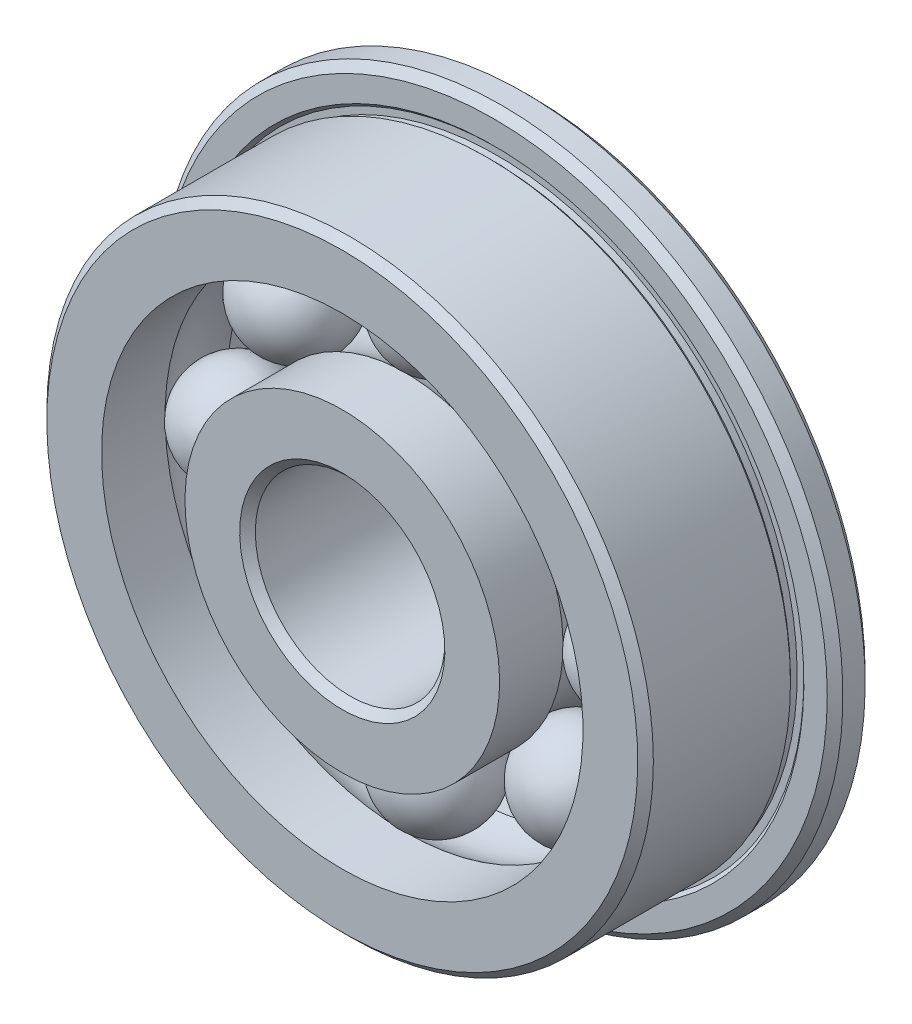
from build123d import *

# Parameters (mm, degrees)
FILLET1_SIZE      = 0.20625
FILLET2_SIZE      = 0.20625
CIRPATTERN3_COUNT = 8


with BuildPart() as part:
    # Sketch2 → Revolve1 (revolve)
    with BuildSketch(Plane(origin=(0, 0, 0), x_dir=(0, 0, -1), z_dir=(1, 0, 0))):
        with BuildLine():
            Line((2.5, 9), (1.5, 9))
            Line((1.5, 9), (1.5, 8.176776695))
            Line((1.5, 8.176776695), (1.588388348, 8.088388348))
            Line((1.588388348, 8.088388348), (1.588388348, 7.911611652))
            Line((1.588388348, 7.911611652), (1.411611652, 7.911611652))
            Line((1.411611652, 7.911611652), (1.323223305, 8))
            Line((1.323223305, 8), (-2.5, 8))
            Line((-2.5, 8), (-2.5, 6.35))
            Line((-2.5, 6.35), (-0.825, 6.35))
            ThreePointArc((-0.825, 6.35), (0, 6.625), (0.825, 6.35))
            Line((0.825, 6.35), (2.5, 6.35))
            Line((2.5, 6.35), (2.5, 9))
        make_face()
        with BuildLine():
            Line((2.5, 2.5), (-2.5, 2.5))
            Line((-2.5, 2.5), (-2.5, 4.15))
            Line((-2.5, 4.15), (-0.825, 4.15))
            ThreePointArc((-0.825, 4.15), (0, 3.875), (0.825, 4.15))
            Line((0.825, 4.15), (2.5, 4.15))
            Line((2.5, 4.15), (2.5, 2.5))
        make_face()
    revolve(axis=Axis((0, 0, 0), (0, 0, -1)))

    # Fillet1
    fillet1_edges = [part.edges().sort_by_distance(p)[0] for p in [
        (0, -9, -2.5),
        (0, -9, -1.5),
        (0, -8, 2.5),
    ]]
    chamfer(fillet1_edges, length=FILLET1_SIZE)

    # Fillet2
    fillet2_edges = [part.edges().sort_by_distance(p)[0] for p in [
        (0, -2.5, -2.5),
        (0, -2.5, 2.5),
    ]]
    chamfer(fillet2_edges, length=FILLET2_SIZE)


with BuildPart() as body_2:
    # Sketch7 → Revolve3 (revolve)
    with BuildSketch(Plane.XY):
        with BuildLine():
            Line((0, 6.625), (0, 3.875))
            ThreePointArc((0, 3.875), (-1.375, 5.25), (0, 6.625))
        make_face()
    revolve(axis=Axis((0, 6.625, 0), (0, -1, 0)))


with BuildPart() as cirpattern3_1:
    # CirPattern3: pattern copy
    add(body_2.part.rotate(Axis((0, 0, 0), (0, 0, -1)), 1 * 360 / CIRPATTERN3_COUNT))


with BuildPart() as cirpattern3_2:
    # CirPattern3: pattern copy
    add(body_2.part.rotate(Axis((0, 0, 0), (0, 0, -1)), 2 * 360 / CIRPATTERN3_COUNT))


with BuildPart() as cirpattern3_3:
    # CirPattern3: pattern copy
    add(body_2.part.rotate(Axis((0, 0, 0), (0, 0, -1)), 3 * 360 / CIRPATTERN3_COUNT))


with BuildPart() as cirpattern3_4:
    # CirPattern3: pattern copy
    add(body_2.part.rotate(Axis((0, 0, 0), (0, 0, -1)), 4 * 360 / CIRPATTERN3_COUNT))


with BuildPart() as cirpattern3_5:
    # CirPattern3: pattern copy
    add(body_2.part.rotate(Axis((0, 0, 0), (0, 0, -1)), 5 * 360 / CIRPATTERN3_COUNT))


with BuildPart() as cirpattern3_6:
    # CirPattern3: pattern copy
    add(body_2.part.rotate(Axis((0, 0, 0), (0, 0, -1)), 6 * 360 / CIRPATTERN3_COUNT))


with BuildPart() as cirpattern3_7:
    # CirPattern3: pattern copy
    add(body_2.part.rotate(Axis((0, 0, 0), (0, 0, -1)), 7 * 360 / CIRPATTERN3_COUNT))


solid = Compound([part.part, body_2.part, cirpattern3_1.part, cirpattern3_2.part, cirpattern3_3.part, cirpattern3_4.part, cirpattern3_5.part, cirpattern3_6.part, cirpattern3_7.part])
